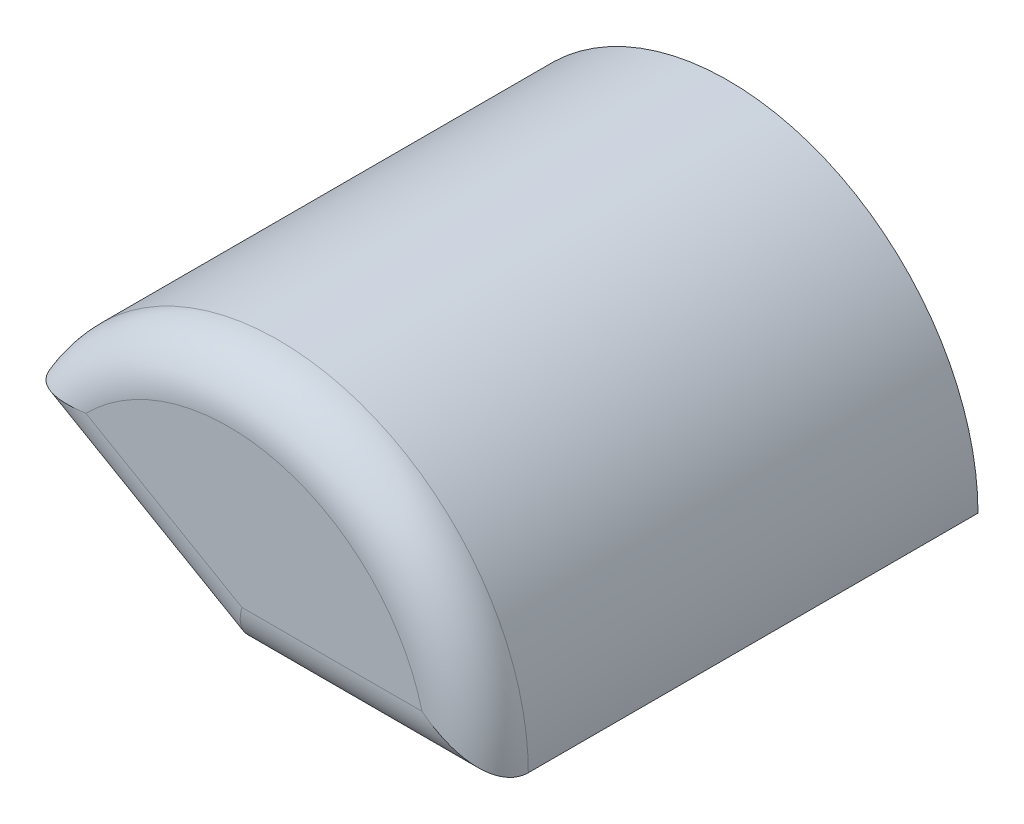
from build123d import *

# Parameters (mm, degrees)
BOSS_EXTRUDE1_DEPTH = 10
FILLET1_R           = 1


with BuildPart() as part:
    # Sketch1 → Boss-Extrude1 (new body)
    with BuildSketch(Plane.XY):
        with BuildLine():
            Line((-4.330127019, 2.5), (0, 0))
            Line((0, 0), (5, 0))
            ThreePointArc((5, 0), (1.294095226, 4.829629131), (-4.330127019, 2.5))
        make_face()
    extrude(amount=BOSS_EXTRUDE1_DEPTH)

    # Fillet1
    fillet1_edges = [part.edges().sort_by_distance(p)[0] for p in [
        (-2.165063509, 1.25, 10),
        (1.294095226, 4.829629131, 10),
        (2.5, 0, 10),
    ]]
    fillet(fillet1_edges, radius=FILLET1_R)


solid = part.part
